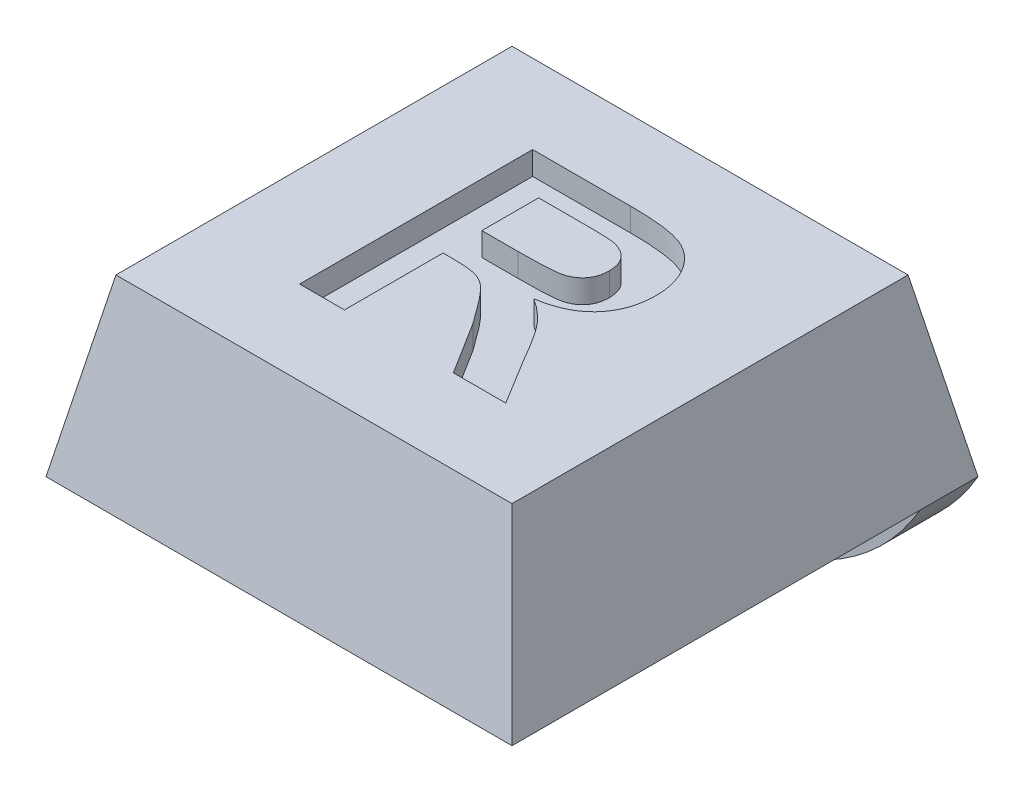
from build123d import *

# Parameters (mm, degrees)
SKETCH1_W               = 8
SKETCH1_H               = 8
BOSS_EXTRUDE1_DEPTH     = 3
CUT_EXTRUDE1_DEPTH      = 12.704699911
CUT_EXTRUDE1_DEPTH_BACK = 12.704699911
CUT_EXTRUDE2_DEPTH      = 11
SKETCH4_R               = 1.8
CUT_EXTRUDE3_DEPTH      = 0.8
SKETCH5_W               = 8
SKETCH5_H               = 1
BOSS_EXTRUDE2_DEPTH     = 2
FILLET1_R               = 4
CUT_EXTRUDE4_DEPTH      = 0.4


with BuildPart() as part:
    # Sketch1 → Boss-Extrude1 (new body)
    with BuildSketch(Plane(origin=(0, 0, 0), x_dir=(1, 0, 0), z_dir=(0, 1, 0))):
        with Locations((4, 4)):
            Rectangle(SKETCH1_W, SKETCH1_H)
    extrude(amount=BOSS_EXTRUDE1_DEPTH)

    # Sketch2 → Cut-Extrude1 (cut, two sides: drawn at the far end of the back side and taken through both)
    with BuildSketch(Plane.XY.offset(-CUT_EXTRUDE1_DEPTH_BACK)):
        Polygon((0, 0), (0.6, 3), (0, 3), align=None)
        Polygon((8, 0), (7.4, 3), (8, 3), align=None)
    extrude(amount=CUT_EXTRUDE1_DEPTH + CUT_EXTRUDE1_DEPTH_BACK, mode=Mode.SUBTRACT)

    # Sketch3 → Cut-Extrude2 (cut)
    with BuildSketch(Plane(origin=(0, 0, 0), x_dir=(0, 0, -1), z_dir=(1, 0, 0))):
        Polygon((0, 0), (0.6, 3), (0, 3), align=None)
        Polygon((8, 3), (7.4, 3), (8, 0), align=None)
    extrude(amount=CUT_EXTRUDE2_DEPTH, mode=Mode.SUBTRACT)

    # Sketch4 → Cut-Extrude3 (cut)
    with BuildSketch(Plane.XZ):
        with Locations(Location((4, -3.75, 0), (0, 0, 270))):
            Circle(SKETCH4_R)
    extrude(amount=-CUT_EXTRUDE3_DEPTH, mode=Mode.SUBTRACT)

    # Sketch5 → Boss-Extrude2 (add)
    with BuildSketch(Plane.XZ):
        with Locations((4, -7.5)):
            Rectangle(SKETCH5_W, SKETCH5_H)
    extrude(amount=BOSS_EXTRUDE2_DEPTH)

    # Fillet1
    # the kernel refuses this fillet: 4 mm, written as the material it takes off along each edge
    with BuildSketch(Plane(origin=(8, -2, -16.660254038), x_dir=(0, 1, 0), z_dir=(0, 0, 1)), Plane(origin=(0, -2, 1.660254038), x_dir=(0, 1, 0), z_dir=(0, 0, -1))) as fillet1_piece_1:
        with BuildLine():
            CenterArc((4, 3.464101615), FILLET1_R, 180, 60)
            Line((0, 3.464101615), (-0.08, 3.464101615))
            Line((-0.08, 3.464101615), (-0.08, 0))
            Line((-0.08, 0), (0, -0.08))
            ThreePointArc((0, -0.08), (1, -0.08), (1.96, -0.069282032))
            Line((1.96, -0.069282032), (2, 0))
        make_face()
    extrude(amount=18.320508076, mode=Mode.SUBTRACT)

    # Sketch6 → Cut-Extrude4 (cut)
    with BuildSketch(Plane(origin=(0, 3, 0), x_dir=(1, 0, 0), z_dir=(0, 1, 0))):
        with BuildLine():
            Line((2.312898911, 2.041410717), (2.312898911, 6.041410717))
            Line((2.312898911, 6.041410717), (3.991584808, 6.041410717))
            add(Edge.make_bspline(
                [(3.991584808, 6.041410717), (4.042601732, 6.041096301), (4.140920681, 6.040490364), (4.283109063, 6.036071747), (4.414238667, 6.026814487), (4.534891188, 6.016330564), (4.644487122, 6.001077132), (4.74345979, 5.982803671), (4.831642566, 5.961627249), (4.910322089, 5.936265049), (4.982061831, 5.90723713), (5.04889092, 5.87268574), (5.111544162, 5.83220454), (5.170983849, 5.787188805), (5.227461685, 5.737569368), (5.279429347, 5.682033053), (5.32779225, 5.621406813), (5.372511371, 5.556195062), (5.411906117, 5.48668575), (5.447902572, 5.415111184), (5.477205044, 5.340709703), (5.50140862, 5.263831792), (5.52074281, 5.184644366), (5.534162371, 5.102946099), (5.542540058, 5.018884869), (5.543287935, 4.962103945), (5.543668142, 4.93323764)],
                knots=[0, 0, 0, 0, 1.675828044, 3.229627355, 4.67171229, 5.993455049, 7.206927059, 8.304770529, 9.29850117, 10.183580433, 11.017754134, 11.837875825, 12.650738409, 13.464925643, 14.285328857, 15.117007378, 15.959673368, 16.830859064, 17.711229498, 18.58228265, 19.460420693, 20.334473227, 21.228207035, 22.135446768, 23.052097822, 24, 24, 24, 24], degree=3))
            add(Edge.make_bspline(
                [(5.543668142, 4.93323764), (5.542962916, 4.896874176), (5.541584712, 4.825809944), (5.528901745, 4.721651895), (5.5100643, 4.622136315), (5.483211668, 4.527125334), (5.446289845, 4.437736414), (5.403428122, 4.352717347), (5.352308317, 4.272356517), (5.293277733, 4.19745058), (5.226389218, 4.127933229), (5.151349641, 4.065235076), (5.06869476, 4.009111084), (4.977924564, 3.959884897), (4.879671091, 3.917801842), (4.77350828, 3.882394441), (4.659916733, 3.853576761), (4.580902516, 3.840017181), (4.540463013, 3.833077384)],
                knots=[0, 0, 0, 0, 1.05911256, 2.069797862, 3.05271628, 4.008392045, 4.940519534, 5.866323021, 6.779546087, 7.71056835, 8.640711998, 9.585328432, 10.554502533, 11.547017206, 12.589327225, 13.664782803, 14.804835066, 16, 16, 16, 16], degree=3))
            add(Edge.make_bspline(
                [(4.540463013, 3.833077384), (4.579572554, 3.807174767), (4.656115253, 3.756479818), (4.762017587, 3.672984601), (4.857092756, 3.585349912), (4.929078878, 3.507419696), (4.984392794, 3.438888442), (5.028929947, 3.378950347), (5.076970406, 3.309970293), (5.128042999, 3.231910907), (5.183657562, 3.145462828), (5.241745689, 3.049302835), (5.303522957, 2.944368887), (5.345058377, 2.871067212), (5.366584808, 2.833077384)],
                knots=[0, 0, 0, 0, 1.285445069, 2.515791127, 3.691898215, 4.826622834, 5.420063933, 6.105349801, 6.873086501, 7.723915395, 8.66222816, 9.690593598, 10.803111229, 12, 12, 12, 12], degree=3))
            Line((5.366584808, 2.833077384), (5.851360449, 2.041410717))
            Line((5.851360449, 2.041410717), (4.952321988, 2.041410717))
            Line((4.952321988, 2.041410717), (4.383411731, 2.949263281))
            add(Edge.make_bspline(
                [(4.383411731, 2.949263281), (4.357283981, 2.985622121), (4.307400733, 3.055038622), (4.235391184, 3.153681722), (4.169508837, 3.241491798), (4.111507042, 3.319740728), (4.058450932, 3.386209972), (4.011951502, 3.442057857), (3.972955886, 3.488482798), (3.928832249, 3.534515131), (3.877499082, 3.581823547), (3.813952721, 3.627691749), (3.748696505, 3.664257396), (3.678779681, 3.692157844), (3.597922987, 3.71161189), (3.500720436, 3.724006591), (3.384115753, 3.733151261), (3.299833928, 3.733519777), (3.254405321, 3.73371841)],
                knots=[0, 0, 0, 0, 1.465447777, 2.797841088, 3.997266218, 5.05856206, 5.985598736, 6.780315439, 7.437430484, 7.969193402, 8.866571936, 9.718200644, 10.52825214, 11.309096006, 12.174169268, 13.242355782, 14.513606761, 16, 16, 16, 16], degree=3))
            Line((3.254405321, 3.73371841), (3.08212968, 3.73371841))
            Line((3.08212968, 3.73371841), (3.08212968, 2.041410717))
            Line((3.08212968, 2.041410717), (2.312898911, 2.041410717))
        make_face()
        with BuildLine():
            Line((3.08212968, 4.400385076), (3.701520706, 4.400385076))
            add(Edge.make_bspline(
                [(3.701520706, 4.400385076), (3.749332843, 4.400487541), (3.840423044, 4.400682752), (3.969955122, 4.403510317), (4.085670885, 4.405910235), (4.186877859, 4.411940131), (4.274028855, 4.417916326), (4.346774263, 4.425683211), (4.405726987, 4.434863419), (4.464610849, 4.449136231), (4.52492793, 4.474003789), (4.589214527, 4.509422512), (4.644158691, 4.555370201), (4.691753027, 4.608490376), (4.728060837, 4.670937972), (4.756498441, 4.739930879), (4.770916908, 4.817002181), (4.773239296, 4.87042263), (4.774437372, 4.89798123)],
                knots=[0, 0, 0, 0, 1.697953026, 3.23488743, 4.60134403, 5.807846676, 6.835100678, 7.703488618, 8.405232423, 8.952775585, 9.851109663, 10.713519226, 11.549115941, 12.382556273, 13.233359028, 14.101746968, 15.020727134, 16, 16, 16, 16], degree=3))
            add(Edge.make_bspline(
                [(4.774437372, 4.89798123), (4.773074786, 4.928811222), (4.770445895, 4.98829272), (4.749714088, 5.072935459), (4.713527564, 5.147705664), (4.663829732, 5.212726785), (4.601441933, 5.267631557), (4.527131165, 5.311213996), (4.441449505, 5.343672387), (4.379650359, 5.355659208), (4.347354039, 5.361923538)],
                knots=[0, 0, 0, 0, 1.062977961, 2.050844577, 2.982300261, 3.90936959, 4.856017476, 5.831122378, 6.86654153, 8, 8, 8, 8], degree=3))
            add(Edge.make_bspline(
                [(4.347354039, 5.361923538), (4.336678458, 5.363096555), (4.311375089, 5.365876852), (4.266692338, 5.367662514), (4.20955971, 5.370407271), (4.139285669, 5.371528992), (4.056498042, 5.373495271), (3.960867626, 5.373856329), (3.852698247, 5.375009885), (3.776307493, 5.374835906), (3.735975834, 5.374744051)],
                knots=[0, 0, 0, 0, 0.42127143, 0.998501726, 1.753681744, 2.66564073, 3.755712164, 5.002818897, 6.417592707, 8, 8, 8, 8], degree=3))
            Line((3.735975834, 5.374744051), (3.08212968, 5.374744051))
            Line((3.08212968, 5.374744051), (3.08212968, 4.400385076))
        make_face(mode=Mode.SUBTRACT)
    extrude(amount=-CUT_EXTRUDE4_DEPTH, mode=Mode.SUBTRACT)


solid = part.part
